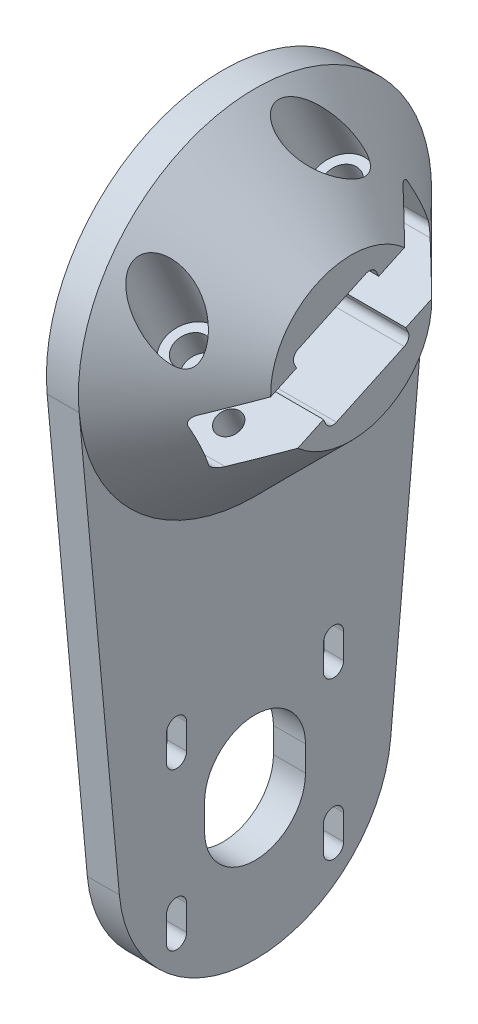
from build123d import *

# Parameters (mm, degrees)
BOSS_EXTRUDE1_DEPTH = 6.35
SKETCH20_R          = 35
BOSS_EXTRUDE5_DEPTH = 19.05
CUT_EXTRUDE14_DEPTH = 123.39448517
CHAMFER1_SIZE       = 19.05
SKETCH22_R          = 3.175
CUT_EXTRUDE15_DEPTH = 129.555411344
SKETCH24_R          = 5
CUT_EXTRUDE16_DEPTH = 134.419011414
SKETCH25_R          = 2.38125
CUT_EXTRUDE17_DEPTH = 10
CUT_EXTRUDE18_DEPTH = 10
CHAMFER2_SIZE       = 2.5
FILLET1_R           = 1.5875


with BuildPart() as part:
    # Sketch1 → Boss-Extrude1 (new body)
    with BuildSketch(Plane(origin=(0, 0, 0), x_dir=(0, 0, -1), z_dir=(1, 0, 0))):
        with BuildLine():
            Line((-34.853407294, -3.2), (-26.886914198, -89.968571429))
            ThreePointArc((-26.886914198, -89.968571429), (0, -114.5), (26.886914198, -89.968571429))
            Line((26.886914198, -89.968571429), (34.853407294, -3.2))
            ThreePointArc((34.853407294, -3.2), (0, 35), (-34.853407294, -3.2))
        make_face()
        Polygon((4.353205728, 11.960334439), (-11.960334439, 4.353205728), (-4.353205728, -11.960334439), (11.960334439, -4.353205728), align=None, mode=Mode.SUBTRACT)
    extrude(amount=BOSS_EXTRUDE1_DEPTH)

    # Sketch20 → Boss-Extrude5 (add)
    with BuildSketch(Plane(origin=(6.35, 0, 0), x_dir=(0, 0, -1), z_dir=(1, 0, 0))):
        with Locations(Location((0, 0, 0), (0, 0, 185.245797084))):
            Circle(SKETCH20_R)
    extrude(amount=BOSS_EXTRUDE5_DEPTH)

    # Sketch21 → Cut-Extrude14 (cut, through all)
    with BuildSketch(Plane.ZY):
        Polygon((-19.067760927, 15.897892729), (-24.435012851, 4.387783834), (-10.840396045, -1.951490092), (-5.473144121, 9.558618803), align=None)
        Polygon((-11.960334439, -4.353205728), (-4.353205728, 11.960334439), (11.960334439, 4.353205728), (4.353205728, -11.960334439), align=None)
        Polygon((10.840396045, 1.951490092), (5.473144121, -9.558618803), (19.067760927, -15.897892729), (24.435012851, -4.387783834), align=None)
    extrude(amount=-CUT_EXTRUDE14_DEPTH, mode=Mode.SUBTRACT)

    # Chamfer1
    # the kernel refuses this chamfer: 19.05 mm, written as the material it takes off along each edge
    with BuildSketch(Plane(origin=(25.4, 0, 0), x_dir=(0, -0.09142857142327497, 0.9958116369713196), z_dir=(0, 0.9958116369713196, 0.09142857142327497))) as chamfer1_piece_1:
        Polygon((35 - CHAMFER1_SIZE, 0), (35, -CHAMFER1_SIZE), (35, 0), align=None)
    revolve(axis=Axis((25.4, 0, 0), (1, 0, 0)), mode=Mode.SUBTRACT)

    # Sketch22 → Cut-Extrude15 (cut, through all)
    with BuildSketch(Plane(origin=(0, 5.755054448, 2.683625962), x_dir=(-1, 0, 0), z_dir=(0, -0.9063077870366495, -0.4226182617407006))):
        with Locations(Location((-13.4, -16.5, 0), (0, 0, 90))):
            Circle(SKETCH22_R)
    cut_extrude15 = extrude(amount=-CUT_EXTRUDE15_DEPTH, mode=Mode.SUBTRACT)

    # Sketch24 → Cut-Extrude16 (cut, through all)
    with BuildSketch(Plane(origin=(0, 10.286593383, 4.796717271), x_dir=(-1, 0, 0), z_dir=(0, -0.9063077870366495, -0.4226182617407006))):
        with Locations(Location((-13.4, -16.5, 0), (0, 0, 90))):
            Circle(SKETCH24_R)
    cut_extrude16 = extrude(amount=-CUT_EXTRUDE16_DEPTH, mode=Mode.SUBTRACT)

    # Sketch25 → Cut-Extrude17 (cut)
    with BuildSketch(Plane(origin=(0, -5.755054448, -2.683625962), x_dir=(1, 0, 0), z_dir=(0, 0.9063077870366495, 0.4226182617407006))):
        with Locations(Location((13.4, -16.5, 0), (0, 0, 270))):
            Circle(SKETCH25_R)
    cut_extrude17 = extrude(amount=-CUT_EXTRUDE17_DEPTH, mode=Mode.SUBTRACT)

    # Mirror1: Cut-Extrude15, Cut-Extrude16, Cut-Extrude17 across plane
    add(cut_extrude15.mirror(Plane(origin=(0, 0, 0), x_dir=(1, 0, 0), z_dir=(0, 0.42261826174070105, -0.9063077870366493))), mode=Mode.SUBTRACT)
    add(cut_extrude16.mirror(Plane(origin=(0, 0, 0), x_dir=(1, 0, 0), z_dir=(0, 0.42261826174070105, -0.9063077870366493))), mode=Mode.SUBTRACT)
    add(cut_extrude17.mirror(Plane(origin=(0, 0, 0), x_dir=(1, 0, 0), z_dir=(0, 0.42261826174070105, -0.9063077870366493))), mode=Mode.SUBTRACT)

    # Sketch19 → Cut-Extrude18 (cut)
    with BuildSketch(Plane(origin=(6.35, 0, 0), x_dir=(0, 0, -1), z_dir=(1, 0, 0))):
        with BuildLine():
            Line((13.556349186, -66.943650814), (13.556349186, -71.943650814))
            ThreePointArc((13.556349186, -71.943650814), (15.556349186, -73.943650814), (17.556349186, -71.943650814))
            Line((17.556349186, -71.943650814), (17.556349186, -66.943650814))
            ThreePointArc((17.556349186, -66.943650814), (15.556349186, -64.943650814), (13.556349186, -66.943650814))
        make_face()
        with BuildLine():
            Line((-10, -82.5), (-10, -87.5))
            ThreePointArc((-10, -87.5), (0, -97.5), (10, -87.5))
            Line((10, -87.5), (10, -82.5))
            ThreePointArc((10, -82.5), (0, -72.5), (-10, -82.5))
        make_face()
        with BuildLine():
            Line((17.556349186, -103.056349186), (17.556349186, -98.056349186))
            ThreePointArc((17.556349186, -98.056349186), (15.556349186, -96.056349186), (13.556349186, -98.056349186))
            Line((13.556349186, -98.056349186), (13.556349186, -103.056349186))
            ThreePointArc((13.556349186, -103.056349186), (15.556349186, -105.056349186), (17.556349186, -103.056349186))
        make_face()
        with BuildLine():
            Line((-17.556349186, -66.943650814), (-17.556349186, -71.943650814))
            ThreePointArc((-17.556349186, -71.943650814), (-15.556349186, -73.943650814), (-13.556349186, -71.943650814))
            Line((-13.556349186, -71.943650814), (-13.556349186, -66.943650814))
            ThreePointArc((-13.556349186, -66.943650814), (-15.556349186, -64.943650814), (-17.556349186, -66.943650814))
        make_face()
        with BuildLine():
            Line((-13.556349186, -103.056349186), (-13.556349186, -98.056349186))
            ThreePointArc((-13.556349186, -98.056349186), (-15.556349186, -96.056349186), (-17.556349186, -98.056349186))
            Line((-17.556349186, -98.056349186), (-17.556349186, -103.056349186))
            ThreePointArc((-17.556349186, -103.056349186), (-15.556349186, -105.056349186), (-13.556349186, -103.056349186))
        make_face()
    extrude(amount=-CUT_EXTRUDE18_DEPTH, mode=Mode.SUBTRACT)


with BuildPart() as body_2:
    # Mirror2: mirrored copy
    add(part.part.mirror(Plane(origin=(0, 0, 0), x_dir=(0, 0, 1), z_dir=(1, 0, 0))))


with BuildPart() as part_1:
    add(part.part)

    # Chamfer2
    chamfer2_edges = [part_1.edges().sort_by_distance(p)[0] for p in [
        (0, -69.443650814, 13.556349186),
        (0, -64.943650814, 15.556349186),
        (0, -69.443650814, 17.556349186),
        (0, -73.943650814, 15.556349186),
        (0, -69.443650814, -17.556349186),
        (0, -64.943650814, -15.556349186),
        (0, -69.443650814, -13.556349186),
        (0, -73.943650814, -15.556349186),
    ]]
    chamfer(chamfer2_edges, length=CHAMFER2_SIZE)

    # Fillet1
    fillet1_edges = [part_1.edges().sort_by_distance(p)[0] for p in [
        (12.7, -4.353205728, -11.960334439),
        (8.262078305, 4.387783834, -24.435012851),
        (12.7, 11.960334439, -4.353205728),
        (8.262078305, 15.897892729, -19.067760927),
        (8.262078305, -4.387783834, 24.435012851),
        (12.7, 4.353205728, 11.960334439),
        (12.7, -11.960334439, 4.353205728),
        (8.262078305, -15.897892729, 19.067760927),
    ]]
    fillet(fillet1_edges, radius=FILLET1_R)


solid = part_1.part
